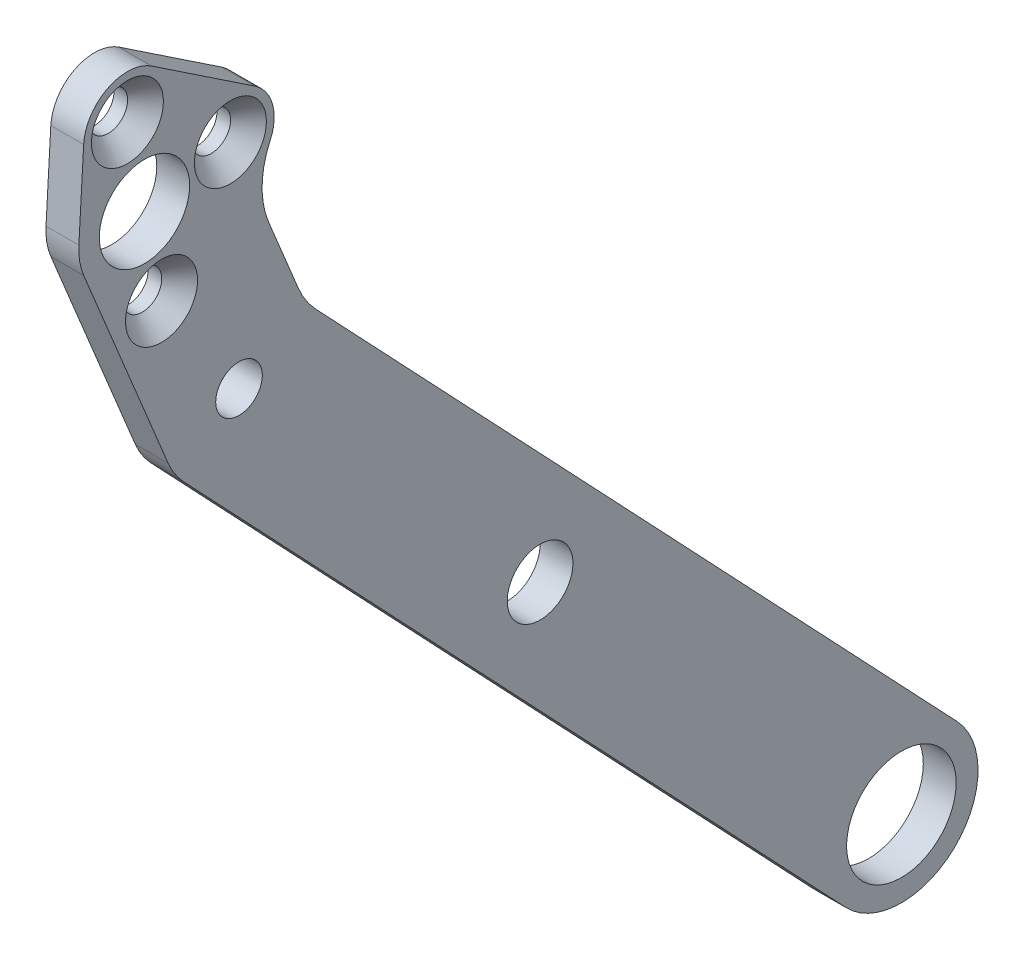
from build123d import *
from OCP.BRepAlgoAPI import BRepAlgoAPI_Cut
from OCP.TopTools import TopTools_ListOfShape

# Parameters (mm, degrees)
BOSS_EXTRUDE1_START                         = 27.641612
SKETCH1_R                                   = 7.9375
BOSS_EXTRUDE1_DEPTH                         = 4.762501
F_1_4_CLEARANCE_HOLE1_D                     = 6.7564
CUT_EXTRUDE1_DEPTH                          = 1429.793432694
CUT_EXTRUDE1_DEPTH_BACK                     = 1429.793432694
SKETCH4_R                                   = 4.7625
BOSS_EXTRUDE2_START                         = 27.641612
BOSS_EXTRUDE2_DEPTH                         = 4.7625
F_1_2_CLEARANCE_HOLE1_D                     = 13.09624
CSK_FOR_10_FLAT_HEAD_SOCKET_CAP_SCR_2_COUNT = 2
CSK_FOR_10_FLAT_HEAD_SOCKET_CAP_SCR_2_PITCH = 17.960512242
CSK_FOR_10_FLAT_HEAD_SOCKET_CAP_SCR_3_COUNT = 2
CSK_FOR_10_FLAT_HEAD_SOCKET_CAP_SCR_3_PITCH = 25.4
FILLET1_R                                   = 12.7


with BuildPart() as part:
    # Sketch1 → Boss-Extrude1 (new body)
    with BuildSketch(Plane(origin=(0, 0, 0), x_dir=(0, 0, -1), z_dir=(1, 0, 0)).offset(BOSS_EXTRUDE1_START)):
        with BuildLine():
            Line((-1394.467062617, 276.836816997), (-1298.446828577, 175.366601392))
            ThreePointArc((-1298.446828577, 175.366601392), (-1282.737360992, 174.933080131), (-1282.303839731, 190.642547716))
            Line((-1282.303839731, 190.642547716), (-1378.32407377, 292.112763322))
            ThreePointArc((-1378.32407377, 292.112763322), (-1394.033541356, 292.546284583), (-1394.467062617, 276.836816997))
        make_face()
        with Locations((-1290.375334154, 183.004574554)):
            Circle(SKETCH1_R, mode=Mode.SUBTRACT)
    extrude(amount=BOSS_EXTRUDE1_DEPTH)

    # 1/4 Clearance Hole1 (through all)
    with Locations(Plane.ZY.offset(-27.641612484)):
        with Locations((1386.395568193, 284.47479016)):
            Hole(F_1_4_CLEARANCE_HOLE1_D / 2)

    # Sketch4 → Cut-Extrude1 (cut, two sides: drawn at the far end of the back side and taken through both)
    with BuildSketch(Plane(origin=(0, 0, 0), x_dir=(0, 0, -1), z_dir=(1, 0, 0)).offset(-CUT_EXTRUDE1_DEPTH_BACK)):
        with Locations((-1342.750007266, 238.351964884)):
            Circle(SKETCH4_R)
    extrude(amount=CUT_EXTRUDE1_DEPTH + CUT_EXTRUDE1_DEPTH_BACK, mode=Mode.SUBTRACT)

    # Sketch5 → Boss-Extrude2 (add)
    with BuildSketch(Plane(origin=(0, 0, 0), x_dir=(0, 0, -1), z_dir=(1, 0, 0)).offset(BOSS_EXTRUDE2_START)):
        with BuildLine():
            Line((-1408.915317884, 326.37077483), (-1409.610698903, 314.093730387))
            ThreePointArc((-1409.610698903, 314.093730387), (-1409.493080384, 311.969736982), (-1408.907003916, 309.924817308))
            Line((-1408.907003916, 309.924817308), (-1396.669308063, 280.239471359))
            ThreePointArc((-1396.669308063, 280.239471359), (-1392.433468222, 293.803853322), (-1378.32407377, 292.112763322))
            Line((-1378.32407377, 292.112763322), (-1376.907390708, 290.615671201))
            Line((-1376.907390708, 290.615671201), (-1385.003560397, 310.254792894))
            ThreePointArc((-1385.003560397, 310.254792894), (-1381.314759969, 315.520916186), (-1384.1151615, 321.308580171))
            Line((-1384.1151615, 321.308580171), (-1399.046290774, 331.290632995))
            ThreePointArc((-1399.046290774, 331.290632995), (-1405.408532388, 331.694665931), (-1408.915317884, 326.37077483))
        make_face()
    extrude(amount=BOSS_EXTRUDE2_DEPTH)

    # 1/2 Clearance Hole1 (through all)
    with Locations(Plane(origin=(32.404112484, 0, 0), x_dir=(0, 0, -1), z_dir=(1, 0, 0))):
        with Locations((-1400.10094117, 313.555090566)):
            Hole(F_1_2_CLEARANCE_HOLE1_D / 2)


with BuildPart() as csk_for_10_flat_head_socket_cap_screw1_tool:
    # Sketch10 → CSK for #10 Flat Head Socket Cap Screw1 (revolve)
    with BuildSketch(Plane(origin=(32.404112484, 326.011681615, 1402.575479395), x_dir=(0, 0, -1), z_dir=(0, 1, 0))):
        Polygon((0, 0), (0, 4.7625), (2.8067, 4.7625), (2.8067, 2.775838967), (5.2197, 0), align=None)
    csk_for_10_flat_head_socket_cap_screw1 = revolve(axis=Axis((38.754112484, 326.011681615, 1402.575479395), (-1, 0, 0)))


with BuildPart() as part_1:
    add(part.part)

    # CSK for #10 Flat Head Socket Cap Screw1: cut by csk_for_10_flat_head_socket_cap_screw1_tool, with a tolerance
    csk_for_10_flat_head_socket_cap_screw1_stock = TopTools_ListOfShape()
    csk_for_10_flat_head_socket_cap_screw1_stock.Append(part_1.part.wrapped)
    csk_for_10_flat_head_socket_cap_screw1_tools = TopTools_ListOfShape()
    csk_for_10_flat_head_socket_cap_screw1_tools.Append(csk_for_10_flat_head_socket_cap_screw1_tool.part.wrapped)
    csk_for_10_flat_head_socket_cap_screw1_cut = BRepAlgoAPI_Cut()
    csk_for_10_flat_head_socket_cap_screw1_cut.SetArguments(csk_for_10_flat_head_socket_cap_screw1_stock)
    csk_for_10_flat_head_socket_cap_screw1_cut.SetTools(csk_for_10_flat_head_socket_cap_screw1_tools)
    csk_for_10_flat_head_socket_cap_screw1_cut.SetFuzzyValue(0.00001)
    csk_for_10_flat_head_socket_cap_screw1_cut.Build()
    add(Compound.cast(csk_for_10_flat_head_socket_cap_screw1_cut.Shape()).solids(), mode=Mode.REPLACE)

    # CSK for _10 Flat Head Socket Cap Scr 2: CSK for #10 Flat Head Socket Cap Screw1 ×2
    with Locations(*[Vector(0, -0.5557777356316841, -0.8313309260313356) * (i * CSK_FOR_10_FLAT_HEAD_SOCKET_CAP_SCR_2_PITCH) for i in range(1, CSK_FOR_10_FLAT_HEAD_SOCKET_CAP_SCR_2_COUNT)]):
        add(csk_for_10_flat_head_socket_cap_screw1, mode=Mode.SUBTRACT)

    # CSK for _10 Flat Head Socket Cap Scr 3: CSK for #10 Flat Head Socket Cap Screw1 ×2
    with Locations(*[Vector(0, -0.9808339409045171, -0.19484552950918363) * (i * CSK_FOR_10_FLAT_HEAD_SOCKET_CAP_SCR_3_PITCH) for i in range(1, CSK_FOR_10_FLAT_HEAD_SOCKET_CAP_SCR_3_COUNT)]):
        add(csk_for_10_flat_head_socket_cap_screw1, mode=Mode.SUBTRACT)

    # Fillet1
    fillet1_edges = [part_1.edges().sort_by_distance(p)[0] for p in [
        (30.022862, 290.615671201, 1376.907390708),
        (30.022862, 310.254792894, 1385.003560397),
    ]]
    fillet(fillet1_edges, radius=FILLET1_R)


solid = part_1.part
